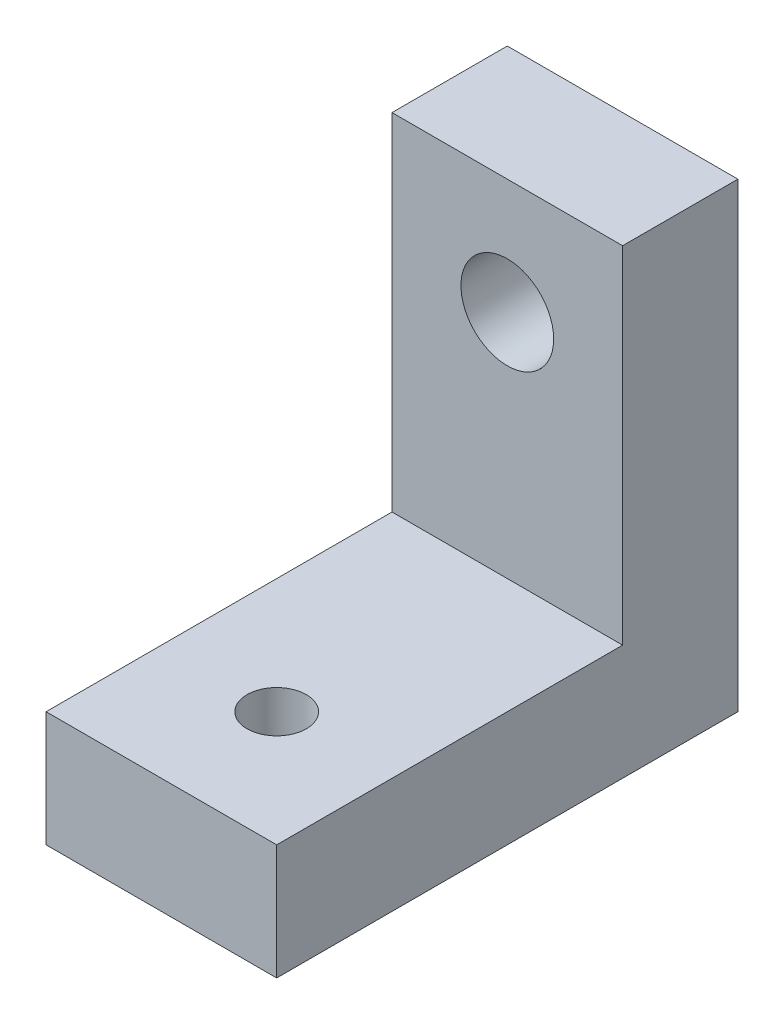
from build123d import *

# Parameters (mm, degrees)
SKETCH1_R           = 2.5527
BOSS_EXTRUDE1_DEPTH = 6.35
SKETCH2_W           = 12.7
SKETCH2_H           = 6.35
BOSS_EXTRUDE2_DEPTH = 19.05
SKETCH3_R           = 1.63195
CUT_EXTRUDE1_DEPTH  = 19.05


with BuildPart() as part:
    # Sketch1 → Boss-Extrude1 (new body)
    with BuildSketch(Plane.XY):
        Polygon((-6.35, 0), (-6.35, -19.05), (6.35, -19.05), (6.35, 0), (6.35, 6.35), (-6.35, 6.35), align=None)
        Circle(SKETCH1_R, mode=Mode.SUBTRACT)
    extrude(amount=BOSS_EXTRUDE1_DEPTH)

    # Sketch2 → Boss-Extrude2 (add)
    with BuildSketch(Plane.XY.offset(6.35)):
        with Locations((0, -15.875)):
            Rectangle(SKETCH2_W, SKETCH2_H)
    extrude(amount=BOSS_EXTRUDE2_DEPTH)

    # Sketch3 → Cut-Extrude1 (cut)
    with BuildSketch(Plane(origin=(0, -12.7, 0), x_dir=(1, 0, 0), z_dir=(0, 1, 0))):
        with Locations((0, -19.05)):
            Circle(SKETCH3_R)
    extrude(amount=-CUT_EXTRUDE1_DEPTH, mode=Mode.SUBTRACT)


solid = part.part
